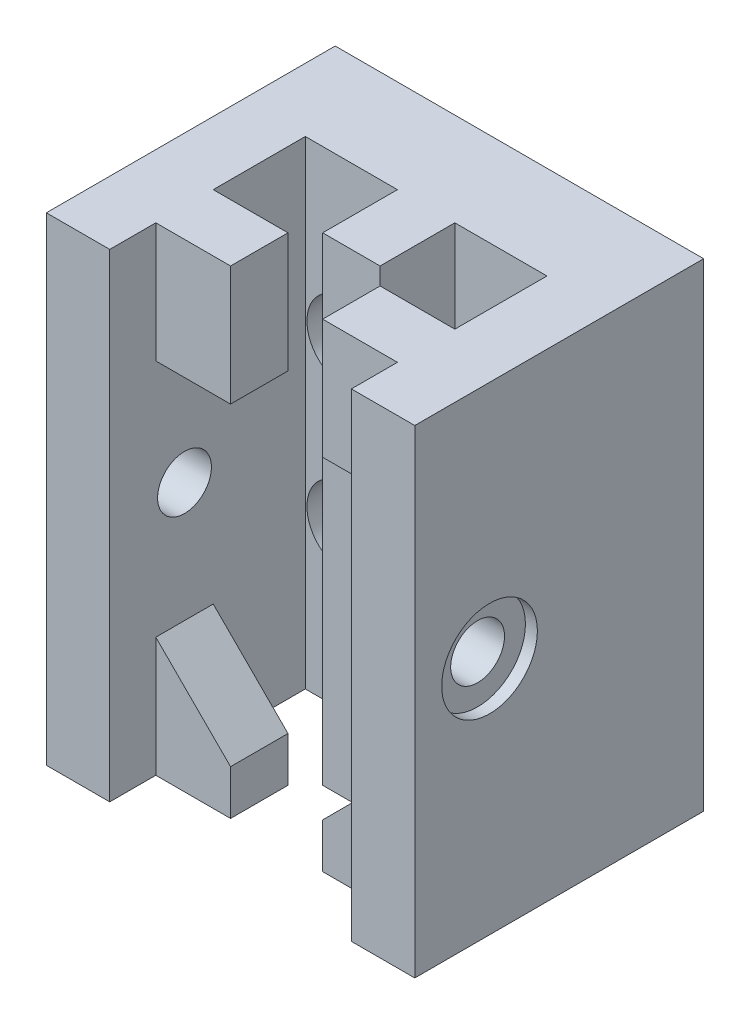
from build123d import *

# Parameters (mm, degrees)
BOSS_EXTRU_1_DEPTH                                = 20
CHAMBRAGE_POUR_VIS_SIX_PANS_CREUX_M41_D           = 4.5
CHAMBRAGE_POUR_VIS_SIX_PANS_CREUX_M41_DEPTH       = 11.55
CHAMBRAGE_POUR_VIS_SIX_PANS_CREUX_M41_CBORE_D     = 8
CHAMBRAGE_POUR_VIS_SIX_PANS_CREUX_M41_CBORE_DEPTH = 1
ESQUISSE6_W                                       = 20.2
ESQUISSE6_H                                       = 20
ENL_V_MAT_EXTRU_1_DEPTH                           = 3
ESQUISSE14_W                                      = 30.8
ESQUISSE14_H                                      = 2.5
BOSS_EXTRU_3_DEPTH                                = 40
CHAMBRAGE_POUR_VIS_SIX_PANS_CREUX_M31_D           = 3.4
CHAMBRAGE_POUR_VIS_SIX_PANS_CREUX_M31_CBORE_D     = 6.5
CHAMBRAGE_POUR_VIS_SIX_PANS_CREUX_M31_CBORE_DEPTH = 3.4
CHANFREIN1_SIZE                                   = 6.25


with BuildPart() as part:
    # Base → Boss.-Extru.1 (new, symmetric)
    with BuildSketch(Plane(origin=(0, 0, 0), x_dir=(1, 0, 0), z_dir=(0, 1, 0))):
        Polygon((-3.85, -2.4), (-3.85, 2.4), (-10.1, 2.4), (-10.1, 10.1), (-2.4, 10.1), (-2.4, 3.85), (2.4, 3.85), (2.4, 10.1), (10.1, 10.1), (10.1, 2.4), (3.85, 2.4), (3.85, -2.4), (10.1, -2.4), (10.1, -6.25), (15.4, -6.25), (15.4, 15.4), (-15.4, 15.4), (-15.4, -6.25), (-10.1, -6.25), (-10.1, -2.4), align=None)
    extrude(amount=BOSS_EXTRU_1_DEPTH, both=True)

    # Chambrage pour vis à six pans creux M41
    with Locations(Plane(origin=(15.4, 0, 0), x_dir=(0, 0, -1), z_dir=(1, 0, 0))):
        with Locations((0, 0)):
            chambrage_pour_vis_six_pans_creux_m41 = CounterBoreHole(CHAMBRAGE_POUR_VIS_SIX_PANS_CREUX_M41_D / 2, CHAMBRAGE_POUR_VIS_SIX_PANS_CREUX_M41_CBORE_D / 2, CHAMBRAGE_POUR_VIS_SIX_PANS_CREUX_M41_CBORE_DEPTH, depth=CHAMBRAGE_POUR_VIS_SIX_PANS_CREUX_M41_DEPTH)

    # Symétrie1: Chambrage pour vis à six pans creux M41 across plane
    add(chambrage_pour_vis_six_pans_creux_m41.mirror(Plane(origin=(0, 0, 0), x_dir=(0, 0, 1), z_dir=(1, 0, 0))), mode=Mode.SUBTRACT)

    # Esquisse6 → Enlèv. mat.-Extru.1 (cut, symmetric)
    with BuildSketch(Plane.XY):
        Rectangle(ESQUISSE6_W, ESQUISSE6_H)
    extrude(amount=ENL_V_MAT_EXTRU_1_DEPTH, both=True, mode=Mode.SUBTRACT)

    # Esquisse14 → Boss.-Extru.3 (add)
    with BuildSketch(Plane.XZ.offset(20)):
        with Locations((0, -16.65)):
            Rectangle(ESQUISSE14_W, ESQUISSE14_H)
    extrude(amount=-BOSS_EXTRU_3_DEPTH)

    # Chambrage pour vis à six pans creux M31 (through all)
    with Locations(Plane.XY.offset(-10.1)):
        with Locations((-6.717514421, 6.717514421), (-6.717514421, -6.717514421), (6.717514421, 6.717514421), (6.717514421, -6.717514421)):
            CounterBoreHole(CHAMBRAGE_POUR_VIS_SIX_PANS_CREUX_M31_D / 2, CHAMBRAGE_POUR_VIS_SIX_PANS_CREUX_M31_CBORE_D / 2, CHAMBRAGE_POUR_VIS_SIX_PANS_CREUX_M31_CBORE_DEPTH)

    # Chanfrein1
    chanfrein1_edges = [part.edges().sort_by_distance(p)[0] for p in [
        (3.85, -10, 0),
        (-3.85, -10, 0),
    ]]
    chamfer(chanfrein1_edges, length=CHANFREIN1_SIZE - 0.0001)  # a hair under: the kernel refuses the full size


solid = part.part
